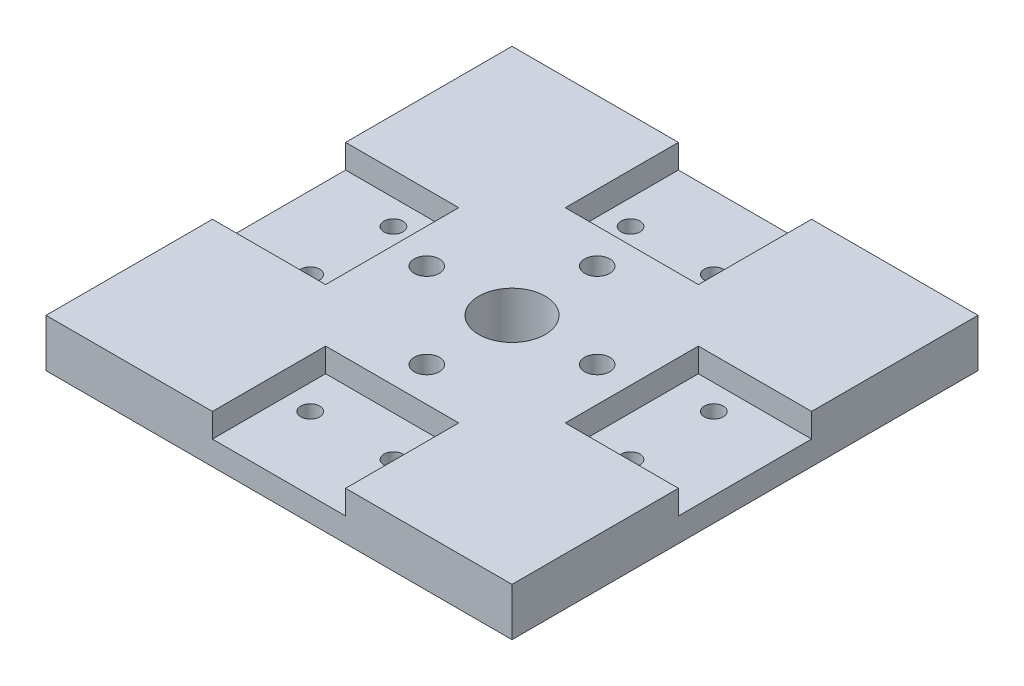
from build123d import *

# Parameters (mm, degrees)
SKETCH1_W           = 88.9
SKETCH1_H           = 88.9
BOSS_EXTRUDE1_DEPTH = 9.144
SKETCH2_W           = 25.4
SKETCH2_H           = 21.59
SKETCH2_W_2         = 21.59
SKETCH2_H_2         = 25.4
CUT_EXTRUDE1_DEPTH  = 4.572
SKETCH3_R           = 2.400000026
CUT_EXTRUDE2_DEPTH  = 127.055673161
SKETCH4_R           = 1.8034
CUT_EXTRUDE3_DEPTH  = 126.806689743
SKETCH5_R           = 6.35
CUT_EXTRUDE4_DEPTH  = 127.055673161


with BuildPart() as part:
    # Sketch1 → Boss-Extrude1 (new body)
    with BuildSketch(Plane(origin=(0, 0, 0), x_dir=(1, 0, 0), z_dir=(0, 1, 0))):
        with Locations((44.45, 44.45)):
            Rectangle(SKETCH1_W, SKETCH1_H)
    extrude(amount=BOSS_EXTRUDE1_DEPTH)

    # Sketch2 → Cut-Extrude1 (cut)
    with BuildSketch(Plane(origin=(0, 9.144, 0), x_dir=(1, 0, 0), z_dir=(0, 1, 0))):
        with Locations((44.45, 78.105)):
            Rectangle(SKETCH2_W, SKETCH2_H)
        with Locations((10.795, 44.45)):
            Rectangle(SKETCH2_W_2, SKETCH2_H_2)
        with Locations((44.45, 10.795)):
            Rectangle(SKETCH2_W, SKETCH2_H)
        with Locations((78.105, 44.45)):
            Rectangle(SKETCH2_W_2, SKETCH2_H_2)
    extrude(amount=-CUT_EXTRUDE1_DEPTH, mode=Mode.SUBTRACT)

    # Sketch3 → Cut-Extrude2 (cut, through all)
    with BuildSketch(Plane(origin=(0, 9.144, 0), x_dir=(1, 0, 0), z_dir=(0, 1, 0))):
        with Locations((28.194, 44.45)):
            Circle(SKETCH3_R)
        with Locations((44.45, 60.706)):
            Circle(SKETCH3_R)
        with Locations((60.706, 44.45)):
            Circle(SKETCH3_R)
        with Locations((44.45, 28.194)):
            Circle(SKETCH3_R)
    extrude(amount=-CUT_EXTRUDE2_DEPTH, mode=Mode.SUBTRACT)

    # Sketch4 → Cut-Extrude3 (cut, through all)
    with BuildSketch(Plane(origin=(0, 4.572, 0), x_dir=(1, 0, 0), z_dir=(0, 1, 0))):
        with Locations((75.0062, 52.3875)):
            Circle(SKETCH4_R)
        with Locations((75.0062, 36.5125)):
            Circle(SKETCH4_R)
        with Locations((52.3875, 75.0062)):
            Circle(SKETCH4_R)
        with Locations((36.5125, 75.0062)):
            Circle(SKETCH4_R)
        with Locations((13.8938, 52.3875)):
            Circle(SKETCH4_R)
        with Locations((13.8938, 36.5125)):
            Circle(SKETCH4_R)
        with Locations((36.5125, 13.8938)):
            Circle(SKETCH4_R)
        with Locations((52.3875, 13.8938)):
            Circle(SKETCH4_R)
    extrude(amount=-CUT_EXTRUDE3_DEPTH, mode=Mode.SUBTRACT)

    # Sketch5 → Cut-Extrude4 (cut, through all)
    with BuildSketch(Plane(origin=(0, 9.144, 0), x_dir=(1, 0, 0), z_dir=(0, 1, 0))):
        with Locations((44.45, 44.45)):
            Circle(SKETCH5_R)
    extrude(amount=-CUT_EXTRUDE4_DEPTH, mode=Mode.SUBTRACT)


solid = part.part
